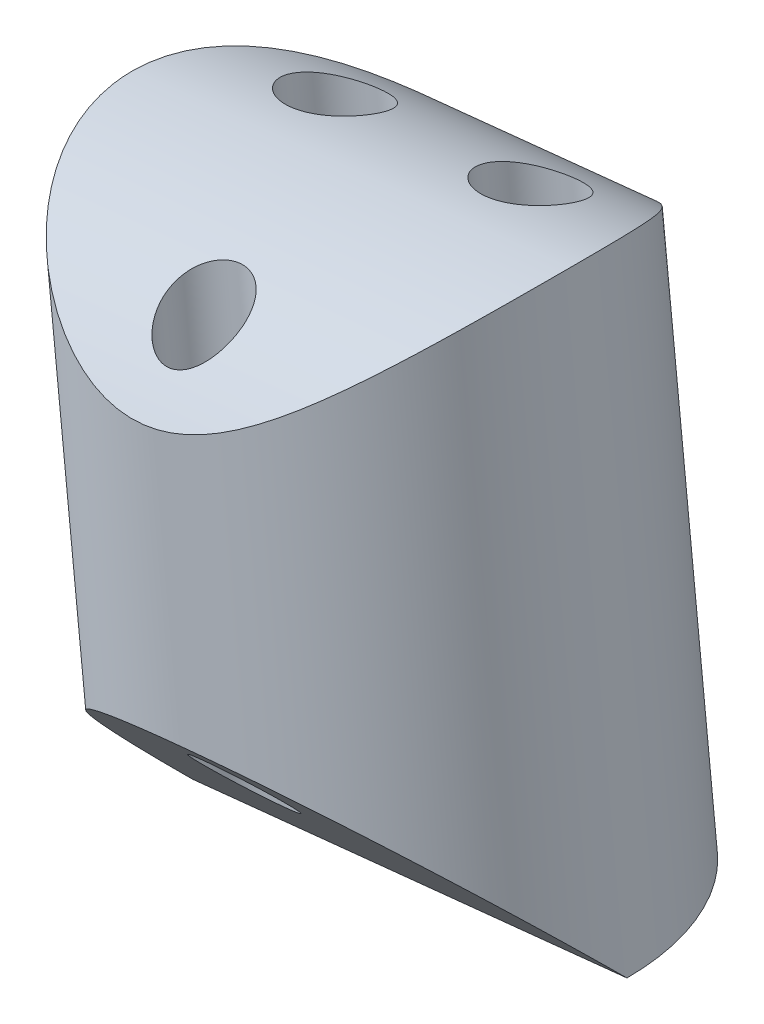
from build123d import *

# Parameters (mm, degrees)
SKETCH3_R               = 8
BOSS_EXTRUDE1_DEPTH     = 21.614736842
CUT_EXTRUDE1_DEPTH      = 220.648426525
CUT_EXTRUDE1_DEPTH_BACK = 220.648426525
CUT_EXTRUDE2_DEPTH      = 220.520875901
CUT_EXTRUDE2_DEPTH_BACK = 220.520875901
CUT_EXTRUDE3_DEPTH      = 26.810125215
CUT_EXTRUDE3_DEPTH_BACK = 26.810125215
SKETCH8_R               = 1.6
SKETCH8_R_2             = 1.4


with BuildPart() as part:
    # Sketch3 → Boss-Extrude1 (new body)
    with BuildSketch(Plane(origin=(-12.082314344, 217.636022384, 0), x_dir=(-0.9946657577296572, -0.10315052302381673, 0), z_dir=(0.10315052302381673, -0.9946657577296572, 0))):
        Circle(SKETCH3_R)
    extrude(amount=BOSS_EXTRUDE1_DEPTH)

    # Sketch4 → Cut-Extrude1 (cut, two sides: drawn at the far end of the back side and taken through both)
    with BuildSketch(Plane(origin=(10.375761543, 1.076004901, 0), x_dir=(0.10315052302381672, -0.9946657577296572, 0), z_dir=(-0.9946657577296572, -0.10315052302381673, 0)).offset(-CUT_EXTRUDE1_DEPTH_BACK)):
        with BuildLine():
            Line((-217.721396158, 8), (-213.721396158, 8))
            ThreePointArc((-213.721396158, 8), (-217.59367935, 0), (-213.721396158, -8))
            Line((-213.721396158, -8), (-217.721396158, -8))
            Line((-217.721396158, -8), (-217.721396158, 8))
        make_face()
    extrude(amount=CUT_EXTRUDE1_DEPTH + CUT_EXTRUDE1_DEPTH_BACK, mode=Mode.SUBTRACT)

    # Sketch5 → Cut-Extrude2 (cut, two sides: drawn at the far end of the back side and taken through both)
    with BuildSketch(Plane(origin=(10.375761543, 1.076004901, 0), x_dir=(0.10315052302381672, -0.9946657577296572, 0), z_dir=(-0.9946657577296572, -0.10315052302381673, 0)).offset(-CUT_EXTRUDE2_DEPTH_BACK)):
        Polygon((-196.106659316, 0), (-204.106659316, 8), (-196.106659316, 8), align=None)
    extrude(amount=CUT_EXTRUDE2_DEPTH + CUT_EXTRUDE2_DEPTH_BACK, mode=Mode.SUBTRACT)

    # Sketch8 → Cut-Extrude3 (cut, two sides: drawn at the far end of the back side and taken through both)
    with BuildSketch(Plane(origin=(-12.082314344, 217.636022384, 0), x_dir=(-0.9946657577296572, -0.10315052302381673, 0), z_dir=(0.10315052302381673, -0.9946657577296572, 0)).offset(-CUT_EXTRUDE3_DEPTH_BACK)):
        with Locations((-3.6, 3)):
            Circle(SKETCH8_R)
        with Locations((3.6, 3)):
            Circle(SKETCH8_R)
        with Locations((0, -5.5)):
            Circle(SKETCH8_R_2)
    extrude(amount=CUT_EXTRUDE3_DEPTH + CUT_EXTRUDE3_DEPTH_BACK, mode=Mode.SUBTRACT)


solid = part.part
